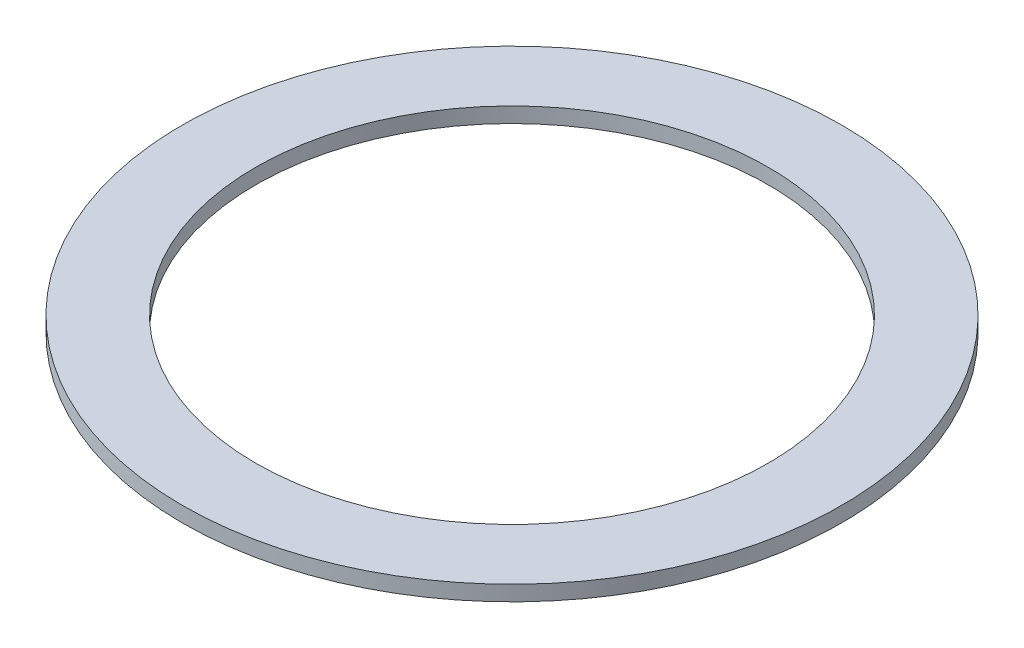
from build123d import *

# Parameters (mm, degrees)
SKETCH1_R           = 34.29
SKETCH1_R_2         = 26.67
BOSS_EXTRUDE1_DEPTH = 1.5875


with BuildPart() as part:
    # Sketch1 → Boss-Extrude1 (new body)
    with BuildSketch(Plane(origin=(0, 0, 0), x_dir=(1, 0, 0), z_dir=(0, 1, 0))):
        Circle(SKETCH1_R)
        Circle(SKETCH1_R_2, mode=Mode.SUBTRACT)
    extrude(amount=BOSS_EXTRUDE1_DEPTH)


solid = part.part
